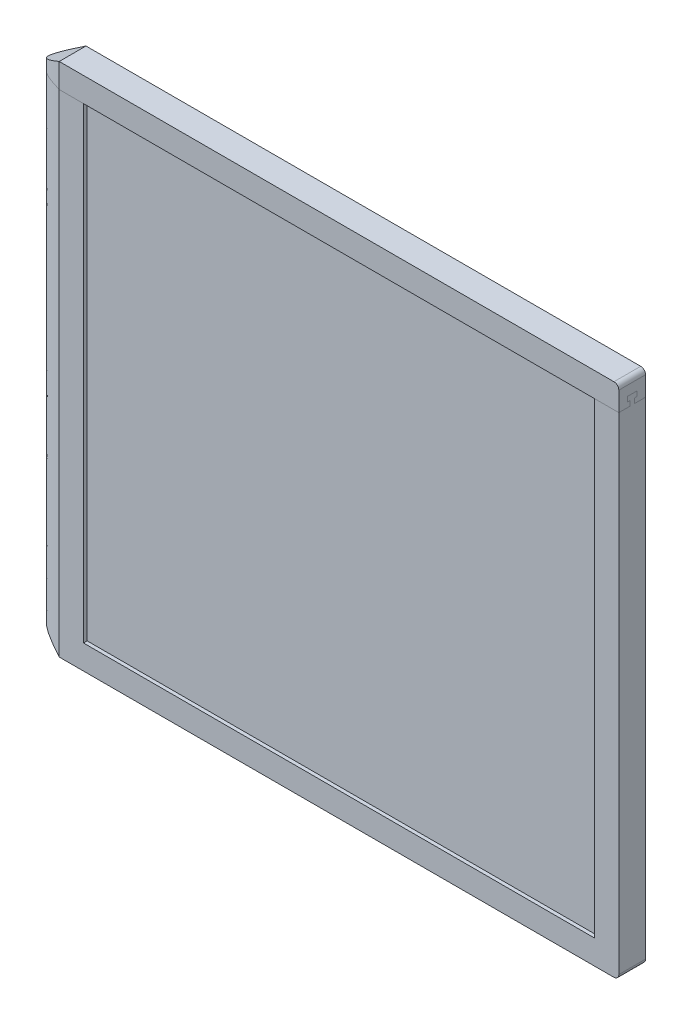
from build123d import *

# Parameters (mm, degrees)
SKETCH_2_W                 = 230
SKETCH_2_H                 = 11
EXTRUDE_1_DEPTH            = 212
SKETCH_3_W                 = 220
SKETCH_3_H                 = 1.5
CUT_EXTRUDE_1_DEPTH        = 198
SKETCH_4_W                 = 210
SKETCH_4_H                 = 192
CUT_EXTRUDE_2_DEPTH        = 203
EXTRUDE_2_DEPTH            = 212
DRAFT_START                = -7
DRAFT_4_DEPTH              = 14
SKETCH_6_W                 = 220
SKETCH_6_H                 = 1.5
EXTRUDE_3_DEPTH            = 198
EXTRUDE_3_2_DEPTH          = 198
FILLET_4_R                 = 2
SPLIT_START                = -2.5
SPLIT_BODIES_2_OUTLINE_W   = 220
SPLIT_BODIES_2_OUTLINE_H   = 5
SPLIT_BODIES_2_DEPTH       = 5
SPLIT_START_2              = -5.5
SPLIT_BODIES_2_2_OUTLINE_W = 220
SPLIT_BODIES_2_2_OUTLINE_H = 5
SPLIT_BODIES_2_2_DEPTH     = 1.5
SPLIT_START_3              = 4
SPLIT_BODIES_2_3_OUTLINE_W = 220
SPLIT_BODIES_2_3_OUTLINE_H = 5
SPLIT_BODIES_2_3_DEPTH     = 1.5
SPLIT_START_4              = 207
SPLIT_BODIES_2_4_DEPTH     = 5
SPLIT_START_5              = 202
SPLIT_BODIES_2_5_OUTLINE_W = 5
SPLIT_BODIES_2_5_OUTLINE_H = 11
SPLIT_BODIES_2_5_DEPTH     = 5
SPLIT_START_6              = -6
SPLIT_BODIES_2_6_DEPTH     = 12
SPLIT_BODIES_2_7_DEPTH     = 10
SKETCH_7_W                 = 2
SKETCH_7_H                 = 4
SKETCH_7_W_2               = 4
SKETCH_7_H_2               = 2
CUT_EXTRUDE_3_DEPTH        = 230
EXTRUDE_4_DEPTH            = 10
PATTERN_LINEAR_1_COUNT     = 2
PATTERN_LINEAR_1_PITCH     = 220


with BuildPart() as part:
    # Эскиз2 → Бобышка-Вытянуть1 (new body)
    with BuildSketch(Plane(origin=(0, 0, 0), x_dir=(1, 0, 0), z_dir=(0, 1, 0))):
        Rectangle(SKETCH_2_W, SKETCH_2_H)
    extrude(amount=EXTRUDE_1_DEPTH)

    # Эскиз3 → Вырез-Вытянуть1 (cut)
    with BuildSketch(Plane(origin=(0, 207, 0), x_dir=(1, 0, 0), z_dir=(0, 1, 0))):
        with Locations((0, 3.25)):
            Rectangle(SKETCH_3_W, SKETCH_3_H)
        with Locations((0, -3.25)):
            Rectangle(SKETCH_3_W, SKETCH_3_H)
    extrude(amount=-CUT_EXTRUDE_1_DEPTH, mode=Mode.SUBTRACT)

    # Эскиз4 → Вырез-Вытянуть2 (cut)
    with BuildSketch(Plane(origin=(0, 0, -5.5), x_dir=(-1, 0, 0), z_dir=(0, 0, -1))):
        with Locations((0, 106)):
            Rectangle(SKETCH_4_W, SKETCH_4_H)
    extrude(amount=-CUT_EXTRUDE_2_DEPTH, mode=Mode.SUBTRACT)


with BuildPart() as body_2:
    # Эскиз5 → Бобышка-Вытянуть2 (new body)
    with BuildSketch(Plane(origin=(0, 0, 0), x_dir=(-1, 0, 0), z_dir=(0, -1, 0))):
        with BuildLine():
            Line((115, -5.5), (115, 5.5))
            add(Edge.make_bspline(
                [(115, 5.5), (135, 0), (115, -5.5)],
                knots=[0, 0, 0, 1, 1, 1], degree=2))
        make_face()
    extrude(amount=-EXTRUDE_2_DEPTH)

    # Уклон4: read off the stored shape, not the designer's step
    # Уклон4 outline → Уклон4 (cut)
    with BuildSketch(Plane.XY.offset(DRAFT_START)):
        Polygon((-124.999999877, 206.226497379), (-115, 212), (-127, 212), (-127, 205.07179677), align=None)
        Polygon((-124.999999877, 5.773502621), (-127, 6.92820323), (-127, 0), (-115, 0), align=None)
    extrude(amount=DRAFT_4_DEPTH, mode=Mode.SUBTRACT)


with BuildPart() as part_1:
    add(part.part)

    # Combine 1: read off the stored shape, not the designer's step
    # Combine 1: union body 2
    add(body_2.part)

    # Скругление4
    fillet_4_edges = [part_1.edges().sort_by_distance(p)[0] for p in [
        (115, 0, 0),
        (115, 212, 0),
    ]]
    fillet(fillet_4_edges, radius=FILLET_4_R)

    # Split Bodies 2 7 outline → Split Bodies 2 7 (cut)
    with BuildSketch(Plane(origin=(0, 0, 0), x_dir=(1, 0, 0), z_dir=(0, 1, 0)).offset(SPLIT_START_5)):
        with BuildLine():
            Line((115, 5.5), (-115, 5.5))
            add(Edge.make_bspline(
                [(-115, -5.5), (-135, 0), (-115, 5.5)],
                knots=[0, 0, 0, 1, 1, 1], degree=2))
            Line((-115, -5.5), (115, -5.5))
            Line((115, -5.5), (115, 5.5))
        make_face()
    extrude(amount=SPLIT_BODIES_2_7_DEPTH, mode=Mode.SUBTRACT)

    # Эскиз8 → Бобышка-Вытянуть4 (add)
    with BuildSketch(Plane(origin=(115, 0, 0), x_dir=(0, 0, -1), z_dir=(1, 0, 0))):
        Polygon((-1, 202), (-1, 204), (-2, 204), (-2, 206), (2, 206), (2, 204), (1, 204), (1, 202), align=None)
    extrude_4 = extrude(amount=-EXTRUDE_4_DEPTH)

    # Линейный массив1: Бобышка-Вытянуть4 ×2
    with Locations(*[(-i * PATTERN_LINEAR_1_PITCH, 0, 0) for i in range(1, PATTERN_LINEAR_1_COUNT)]):
        add(extrude_4)


with BuildPart() as body_2_2:
    # Эскиз6 → Бобышка-Вытянуть3 (new body)
    with BuildSketch(Plane(origin=(0, 9, 0), x_dir=(1, 0, 0), z_dir=(0, 1, 0))):
        with Locations((0, 3.25)):
            Rectangle(SKETCH_6_W, SKETCH_6_H)
    extrude(amount=EXTRUDE_3_DEPTH)


with BuildPart() as body_3:
    # Эскиз6 → Extrude 3 2 (new body)
    with BuildSketch(Plane(origin=(0, 9, 0), x_dir=(1, 0, 0), z_dir=(0, 1, 0))):
        with Locations((0, -3.25)):
            Rectangle(SKETCH_6_W, SKETCH_6_H)
    extrude(amount=EXTRUDE_3_2_DEPTH)


with BuildPart() as body_4:
    # Split Bodies 2: read off the stored shape, not the designer's step
    # Split Bodies 2 outline → Split Bodies 2 (new body)
    with BuildSketch(Plane.XY.offset(SPLIT_START)):
        with Locations((0, 204.5)):
            Rectangle(SPLIT_BODIES_2_OUTLINE_W, SPLIT_BODIES_2_OUTLINE_H)
    extrude(amount=SPLIT_BODIES_2_DEPTH)

    # Split Bodies 2 2 outline → Split Bodies 2 2 (add)
    with BuildSketch(Plane.XY.offset(SPLIT_START_2)):
        with Locations((0, 204.5)):
            Rectangle(SPLIT_BODIES_2_2_OUTLINE_W, SPLIT_BODIES_2_2_OUTLINE_H)
    extrude(amount=SPLIT_BODIES_2_2_DEPTH)

    # Split Bodies 2 3 outline → Split Bodies 2 3 (add)
    with BuildSketch(Plane.XY.offset(SPLIT_START_3)):
        with Locations((0, 204.5)):
            Rectangle(SPLIT_BODIES_2_3_OUTLINE_W, SPLIT_BODIES_2_3_OUTLINE_H)
    extrude(amount=SPLIT_BODIES_2_3_DEPTH)

    # Split Bodies 2 4 outline → Split Bodies 2 4 (add)
    with BuildSketch(Plane(origin=(0, 0, 0), x_dir=(1, 0, 0), z_dir=(0, 1, 0)).offset(SPLIT_START_4)):
        with BuildLine():
            add(Edge.make_bspline(
                [(-115, -5.5), (-135, 0), (-115, 5.5)],
                knots=[0, 0, 0, 1, 1, 1], degree=2))
            Line((-115, -5.5), (115, -5.5))
            Line((115, -5.5), (115, 5.5))
            Line((115, 5.5), (-115, 5.5))
        make_face()
    extrude(amount=SPLIT_BODIES_2_4_DEPTH)

    # Split Bodies 2 5 outline → Split Bodies 2 5 (add)
    with BuildSketch(Plane(origin=(0, 0, 0), x_dir=(1, 0, 0), z_dir=(0, 1, 0)).offset(SPLIT_START_5)):
        with BuildLine():
            add(Edge.make_bspline(
                [(-115, -5.5), (-135, 0), (-115, 5.5)],
                knots=[0, 0, 0, 1, 1, 1], degree=2))
            Line((-115, -5.5), (-110, -5.5))
            Line((-110, -5.5), (-110, 5.5))
            Line((-110, 5.5), (-115, 5.5))
        make_face()
        with Locations((112.5, 0)):
            Rectangle(SPLIT_BODIES_2_5_OUTLINE_W, SPLIT_BODIES_2_5_OUTLINE_H)
    extrude(amount=SPLIT_BODIES_2_5_DEPTH)

    # Split Bodies 2 6 outline → Split Bodies 2 6 (cut)
    with BuildSketch(Plane.XY.offset(SPLIT_START_6)):
        with BuildLine():
            Line((-111.535898385, 214), (-115, 212))
            Line((-115, 212), (113, 212))
            ThreePointArc((113, 212), (114.414213562, 211.414213562), (115, 210))
            Line((115, 210), (115, 214))
            Line((115, 214), (-111.535898385, 214))
        make_face()
        Polygon((-124.999999877, 206.226497379), (-115, 212), (-126, 212.000000152), (-126, 205.649147039), align=None)
    extrude(amount=SPLIT_BODIES_2_6_DEPTH, mode=Mode.SUBTRACT)

    # Эскиз7 → Вырез-Вытянуть3 (cut)
    with BuildSketch(Plane(origin=(115, 0, 0), x_dir=(0, 0, -1), z_dir=(1, 0, 0))):
        with Locations((0, 204)):
            Rectangle(SKETCH_7_W, SKETCH_7_H)
        with Locations((0, 205)):
            Rectangle(SKETCH_7_W_2, SKETCH_7_H_2)
    extrude(amount=-CUT_EXTRUDE_3_DEPTH, mode=Mode.SUBTRACT)


solid = Compound([part_1.part, body_2_2.part, body_3.part, body_4.part])
